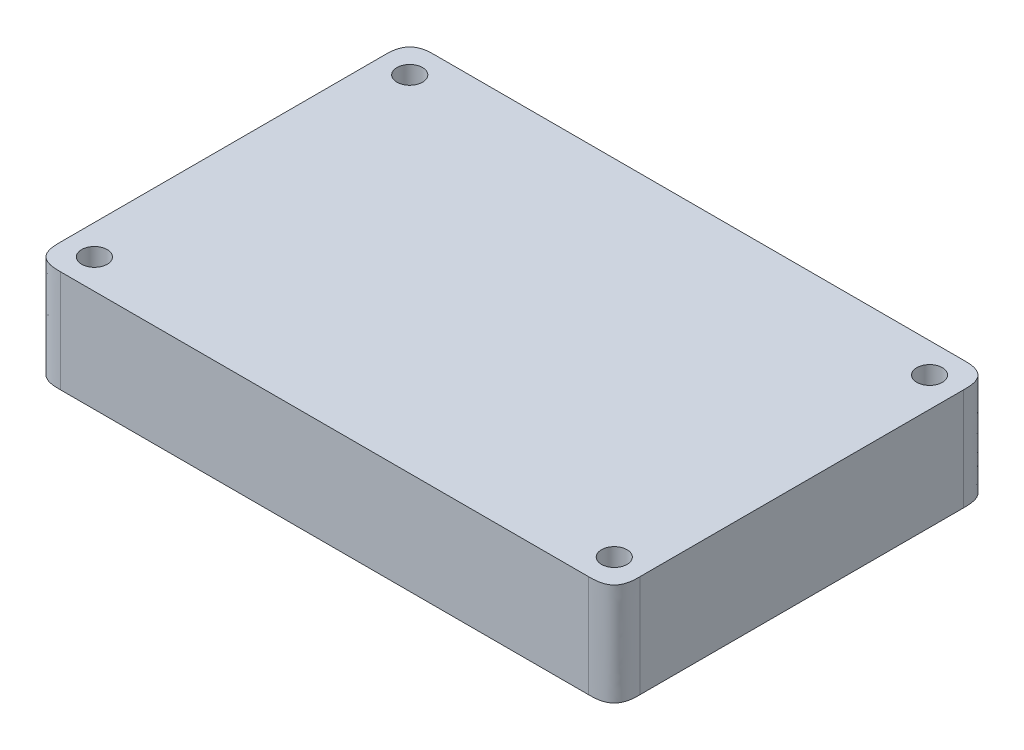
from build123d import *

# Parameters (mm, degrees)
SKETCH_1_W      = 68
SKETCH_1_H      = 44
SKETCH_1_R      = 1.5
EXTRUDE_1_DEPTH = 12
FILLET_1_SIZE   = 3


with BuildPart() as part:
    # 草图1 → 凸台-拉伸1 (new body)
    with BuildSketch(Plane(origin=(0, 0, 0), x_dir=(1, 0, 0), z_dir=(0, 1, 0))):
        with Locations((2.141772152, 0)):
            Rectangle(SKETCH_1_W, SKETCH_1_H)
        with Locations(Location((-28.358227848, -18.5, 0), (0, 0, 270))):
            Circle(SKETCH_1_R, mode=Mode.SUBTRACT)
        with Locations(Location((32.641772152, -18.5, 0), (0, 0, 90))):
            Circle(SKETCH_1_R, mode=Mode.SUBTRACT)
        with Locations(Location((32.641772152, 18.5, 0), (0, 0, 270))):
            Circle(SKETCH_1_R, mode=Mode.SUBTRACT)
        with Locations(Location((-28.358227848, 18.5, 0), (0, 0, 90))):
            Circle(SKETCH_1_R, mode=Mode.SUBTRACT)
    extrude(amount=EXTRUDE_1_DEPTH)

    # 圆角1
    # a fillet whose section is not a circle: 3 mm, written as the material it takes off along each edge
    with BuildSketch(Plane(origin=(-31.858227848, -7.5, -22), x_dir=(1, 0, 0), z_dir=(0, 1, 0))) as fillet_1_piece_1:
        with BuildLine():
            add(Edge.make_bspline([(FILLET_1_SIZE, 0), (FILLET_1_SIZE * 0.831801948466, 0), (FILLET_1_SIZE * 0.663603896932, 0), (FILLET_1_SIZE * 0.292893218813, -FILLET_1_SIZE * 0.0716919198361), (FILLET_1_SIZE * 0.0716919198361, -FILLET_1_SIZE * 0.292893218813), (0, -FILLET_1_SIZE * 0.663603896932), (0, -FILLET_1_SIZE * 0.831801948466), (0, -FILLET_1_SIZE)], knots=[0, 0, 0, 0, 0, 0, 0.5, 0.5, 1, 1, 1, 1, 1, 1], degree=5))
            Line((0, -FILLET_1_SIZE), (0, 0))
            Line((0, 0), (FILLET_1_SIZE, 0))
        make_face()
    extrude(amount=27, mode=Mode.SUBTRACT)
    with BuildSketch(Plane(origin=(36.141772152, -7.5, -22), x_dir=(-1, 0, 0), z_dir=(0, 1, 0)), Plane(origin=(-31.858227848, -7.5, 22), x_dir=(1, 0, 0), z_dir=(0, 1, 0)), Plane(origin=(36.141772152, -7.5, 22), x_dir=(0, 0, -1), z_dir=(0, 1, 0))) as fillet_1_piece_2:
        with BuildLine():
            add(Edge.make_bspline([(FILLET_1_SIZE, 0), (FILLET_1_SIZE * 0.831801948466, 0), (FILLET_1_SIZE * 0.663603896932, 0), (FILLET_1_SIZE * 0.292893218813, FILLET_1_SIZE * 0.0716919198361), (FILLET_1_SIZE * 0.0716919198361, FILLET_1_SIZE * 0.292893218813), (0, FILLET_1_SIZE * 0.663603896932), (0, FILLET_1_SIZE * 0.831801948466), (0, FILLET_1_SIZE)], knots=[0, 0, 0, 0, 0, 0, 0.5, 0.5, 1, 1, 1, 1, 1, 1], degree=5))
            Line((0, FILLET_1_SIZE), (0, 0))
            Line((0, 0), (FILLET_1_SIZE, 0))
        make_face()
    extrude(amount=27, mode=Mode.SUBTRACT)


solid = part.part
